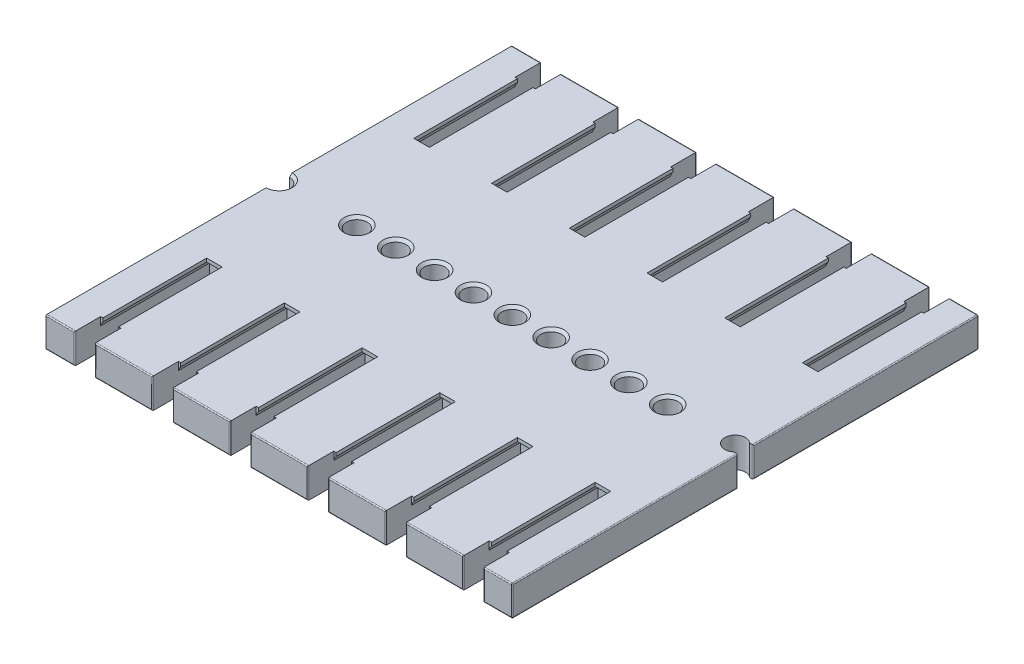
from build123d import *

# Parameters (mm, degrees)
SKETCH_1_W                         = 180
SKETCH_1_H                         = 90
EXTRUDE_1_DEPTH                    = 5.8
CUT_EXTRUDE_1_DEPTH                = 26
SKETCH_3_W                         = 3
SKETCH_3_H                         = 0.677124344
EXTRUDE_2_DEPTH                    = 1
SKETCH_4_W                         = 3.9
SKETCH_4_H                         = 5.8
CUT_EXTRUDE_2_DEPTH                = 5
PATTERN_LINEAR_4_COUNT             = 12
PATTERN_LINEAR_4_PITCH             = 15
PATTERN_LINEAR_4_COPY_1_DEPTH      = 26
PATTERN_LINEAR_4_COPY_2_DEPTH      = 26
PATTERN_LINEAR_4_COPY_3_DEPTH      = 26
PATTERN_LINEAR_4_COPY_4_DEPTH      = 26
PATTERN_LINEAR_4_COPY_5_DEPTH      = 26
PATTERN_LINEAR_4_COPY_6_DEPTH      = 26
PATTERN_LINEAR_4_COPY_7_DEPTH      = 26
PATTERN_LINEAR_4_COPY_8_DEPTH      = 26
PATTERN_LINEAR_4_COPY_9_DEPTH      = 26
PATTERN_LINEAR_4_COPY_10_DEPTH     = 26
PATTERN_LINEAR_4_COPY_11_DEPTH     = 26
PATTERN_LINEAR_4_COPY_12_SKETCH_W  = 3
PATTERN_LINEAR_4_COPY_12_SKETCH_H  = 0.677124344
PATTERN_LINEAR_4_COPY_12_DEPTH     = 1
PATTERN_LINEAR_4_COPY_13_SKETCH_W  = 3
PATTERN_LINEAR_4_COPY_13_SKETCH_H  = 0.677124344
PATTERN_LINEAR_4_COPY_13_DEPTH     = 1
PATTERN_LINEAR_4_COPY_14_SKETCH_W  = 3
PATTERN_LINEAR_4_COPY_14_SKETCH_H  = 0.677124344
PATTERN_LINEAR_4_COPY_14_DEPTH     = 1
PATTERN_LINEAR_4_COPY_15_SKETCH_W  = 3
PATTERN_LINEAR_4_COPY_15_SKETCH_H  = 0.677124344
PATTERN_LINEAR_4_COPY_15_DEPTH     = 1
PATTERN_LINEAR_4_COPY_16_SKETCH_W  = 3
PATTERN_LINEAR_4_COPY_16_SKETCH_H  = 0.677124344
PATTERN_LINEAR_4_COPY_16_DEPTH     = 1
PATTERN_LINEAR_4_COPY_17_SKETCH_W  = 3
PATTERN_LINEAR_4_COPY_17_SKETCH_H  = 0.677124344
PATTERN_LINEAR_4_COPY_17_DEPTH     = 1
PATTERN_LINEAR_4_COPY_18_SKETCH_W  = 3
PATTERN_LINEAR_4_COPY_18_SKETCH_H  = 0.677124344
PATTERN_LINEAR_4_COPY_18_DEPTH     = 1
PATTERN_LINEAR_4_COPY_19_SKETCH_W  = 3
PATTERN_LINEAR_4_COPY_19_SKETCH_H  = 0.677124344
PATTERN_LINEAR_4_COPY_19_DEPTH     = 1
PATTERN_LINEAR_4_COPY_20_SKETCH_W  = 3
PATTERN_LINEAR_4_COPY_20_SKETCH_H  = 0.677124344
PATTERN_LINEAR_4_COPY_20_DEPTH     = 1
PATTERN_LINEAR_4_COPY_21_SKETCH_W  = 3
PATTERN_LINEAR_4_COPY_21_SKETCH_H  = 0.677124344
PATTERN_LINEAR_4_COPY_21_DEPTH     = 1
PATTERN_LINEAR_4_COPY_22_SKETCH_W  = 3
PATTERN_LINEAR_4_COPY_22_SKETCH_H  = 0.677124344
PATTERN_LINEAR_4_COPY_22_DEPTH     = 1
PATTERN_LINEAR_4_COPY_23_SKETCH_W  = 3.9
PATTERN_LINEAR_4_COPY_23_SKETCH_H  = 5.8
PATTERN_LINEAR_4_COPY_23_DEPTH     = 5
PATTERN_LINEAR_4_COPY_24_SKETCH_W  = 3.9
PATTERN_LINEAR_4_COPY_24_SKETCH_H  = 5.8
PATTERN_LINEAR_4_COPY_24_DEPTH     = 5
PATTERN_LINEAR_4_COPY_25_SKETCH_W  = 3.9
PATTERN_LINEAR_4_COPY_25_SKETCH_H  = 5.8
PATTERN_LINEAR_4_COPY_25_DEPTH     = 5
PATTERN_LINEAR_4_COPY_26_SKETCH_W  = 3.9
PATTERN_LINEAR_4_COPY_26_SKETCH_H  = 5.8
PATTERN_LINEAR_4_COPY_26_DEPTH     = 5
PATTERN_LINEAR_4_COPY_27_SKETCH_W  = 3.9
PATTERN_LINEAR_4_COPY_27_SKETCH_H  = 5.8
PATTERN_LINEAR_4_COPY_27_DEPTH     = 5
PATTERN_LINEAR_4_COPY_28_SKETCH_W  = 3.9
PATTERN_LINEAR_4_COPY_28_SKETCH_H  = 5.8
PATTERN_LINEAR_4_COPY_28_DEPTH     = 5
PATTERN_LINEAR_4_COPY_29_SKETCH_W  = 3.9
PATTERN_LINEAR_4_COPY_29_SKETCH_H  = 5.8
PATTERN_LINEAR_4_COPY_29_DEPTH     = 5
PATTERN_LINEAR_4_COPY_30_SKETCH_W  = 3.9
PATTERN_LINEAR_4_COPY_30_SKETCH_H  = 5.8
PATTERN_LINEAR_4_COPY_30_DEPTH     = 5
PATTERN_LINEAR_4_COPY_31_SKETCH_W  = 3.9
PATTERN_LINEAR_4_COPY_31_SKETCH_H  = 5.8
PATTERN_LINEAR_4_COPY_31_DEPTH     = 5
PATTERN_LINEAR_4_COPY_32_SKETCH_W  = 3.9
PATTERN_LINEAR_4_COPY_32_SKETCH_H  = 5.8
PATTERN_LINEAR_4_COPY_32_DEPTH     = 5
PATTERN_LINEAR_4_COPY_33_SKETCH_W  = 3.9
PATTERN_LINEAR_4_COPY_33_SKETCH_H  = 5.8
PATTERN_LINEAR_4_COPY_33_DEPTH     = 5
CUT_EXTRUDE_3_REACH                = 102.79
SKETCH_6_R                         = 2
CHAMFER_1_SIZE                     = 0.5
PATTERN_LINEAR_5_COUNT             = 11
PATTERN_LINEAR_5_PITCH             = 15
CHAMFER_1_OF_PATTERN_LINEAR_5_SIZE = 0.5
CUT_EXTRUDE_4_REACH                = 102.79
SKETCH_7_R                         = 2
CHAMFER_2_SIZE                     = 0.5
PATTERN_LINEAR_7_COUNT             = 4
PATTERN_LINEAR_7_PITCH             = 15
CHAMFER_2_OF_PATTERN_LINEAR_7_SIZE = 0.5
CUT_EXTRUDE_5_REACH                = 102.79
FILLET_4_R                         = 0.2
CUT_EXTRUDE_7_REACH                = 102.79
SKETCH_9_W                         = 94.158249158
SKETCH_9_H                         = 98.711355984


# Read off the part's stored shape, not the designer's step: 镜向5
with BuildPart() as part:
    # 草图1 → 凸台-拉伸1 (new body)
    with BuildSketch(Plane(origin=(0, 0, 0), x_dir=(1, 0, 0), z_dir=(0, 1, 0))):
        Rectangle(SKETCH_1_W, SKETCH_1_H)
    extrude(amount=EXTRUDE_1_DEPTH)

    # 草图2 → 切除-拉伸1 (cut)
    with BuildSketch(Plane.XY.offset(45)):
        with BuildLine():
            Line((-81, 5.8), (-84, 5.8))
            Line((-84, 5.8), (-84, 5.122875656))
            ThreePointArc((-84, 5.122875656), (-84.280042303, 4.711838473), (-84.45, 4.244409721))
            Line((-84.45, 4.244409721), (-84.45, 1.555590279))
            ThreePointArc((-84.45, 1.555590279), (-84.280042303, 1.088161527), (-84, 0.677124344))
            Line((-84, 0.677124344), (-84, 0))
            Line((-84, 0), (-81, 0))
            Line((-81, 0), (-81, 0.677124344))
            ThreePointArc((-81, 0.677124344), (-80.719957697, 1.088161527), (-80.55, 1.555590279))
            Line((-80.55, 1.555590279), (-80.55, 4.244409721))
            ThreePointArc((-80.55, 4.244409721), (-80.719957697, 4.711838473), (-81, 5.122875656))
            Line((-81, 5.122875656), (-81, 5.8))
        make_face()
    cut_extrude_1 = extrude(amount=-CUT_EXTRUDE_1_DEPTH, mode=Mode.SUBTRACT)

    # 草图3 → 凸台-拉伸2 (add)
    with BuildSketch(Plane.XY.offset(19)):
        with Locations((-82.5, 5.461437828)):
            Rectangle(SKETCH_3_W, SKETCH_3_H)
        with Locations((-82.5, 0.338562172)):
            Rectangle(SKETCH_3_W, SKETCH_3_H)
    extrude_2 = extrude(amount=EXTRUDE_2_DEPTH)

    # 草图4 → 切除-拉伸2 (cut)
    with BuildSketch(Plane.XY.offset(45)):
        with Locations((-82.5, 2.9)):
            Rectangle(SKETCH_4_W, SKETCH_4_H)
    cut_extrude_2 = extrude(amount=-CUT_EXTRUDE_2_DEPTH, mode=Mode.SUBTRACT)

    # 镜向4: 切除-拉伸1, 凸台-拉伸2, 切除-拉伸2 across plane
    add(cut_extrude_1.mirror(Plane.XY), mode=Mode.SUBTRACT)
    add(extrude_2.mirror(Plane.XY))
    add(cut_extrude_2.mirror(Plane.XY), mode=Mode.SUBTRACT)

    # 阵列(线性)4: 切除-拉伸1, 凸台-拉伸2, 切除-拉伸2 ×12
    with Locations(*[(i * PATTERN_LINEAR_4_PITCH, 0, 0) for i in range(1, PATTERN_LINEAR_4_COUNT)]):
        add(cut_extrude_1, mode=Mode.SUBTRACT)
        add(extrude_2)
        add(cut_extrude_2, mode=Mode.SUBTRACT)

    # 阵列(线性)4 copy 1 sketch → 阵列(线性)4 copy 1 (cut)
    with BuildSketch(Plane(origin=(15, 0, -45), x_dir=(1, 0, 0), z_dir=(0, 0, -1))):
        with BuildLine():
            Line((-81, -5.8), (-84, -5.8))
            Line((-84, -5.8), (-84, -5.122875656))
            ThreePointArc((-84, -5.122875656), (-84.280042303, -4.711838473), (-84.45, -4.244409721))
            Line((-84.45, -4.244409721), (-84.45, -1.555590279))
            ThreePointArc((-84.45, -1.555590279), (-84.280042303, -1.088161527), (-84, -0.677124344))
            Line((-84, -0.677124344), (-84, 0))
            Line((-84, 0), (-81, 0))
            Line((-81, 0), (-81, -0.677124344))
            ThreePointArc((-81, -0.677124344), (-80.719957697, -1.088161527), (-80.55, -1.555590279))
            Line((-80.55, -1.555590279), (-80.55, -4.244409721))
            ThreePointArc((-80.55, -4.244409721), (-80.719957697, -4.711838473), (-81, -5.122875656))
            Line((-81, -5.122875656), (-81, -5.8))
        make_face()
    extrude(amount=-PATTERN_LINEAR_4_COPY_1_DEPTH, mode=Mode.SUBTRACT)

    # 阵列(线性)4 copy 2 sketch → 阵列(线性)4 copy 2 (cut)
    with BuildSketch(Plane(origin=(30, 0, -45), x_dir=(1, 0, 0), z_dir=(0, 0, -1))):
        with BuildLine():
            Line((-81, -5.8), (-84, -5.8))
            Line((-84, -5.8), (-84, -5.122875656))
            ThreePointArc((-84, -5.122875656), (-84.280042303, -4.711838473), (-84.45, -4.244409721))
            Line((-84.45, -4.244409721), (-84.45, -1.555590279))
            ThreePointArc((-84.45, -1.555590279), (-84.280042303, -1.088161527), (-84, -0.677124344))
            Line((-84, -0.677124344), (-84, 0))
            Line((-84, 0), (-81, 0))
            Line((-81, 0), (-81, -0.677124344))
            ThreePointArc((-81, -0.677124344), (-80.719957697, -1.088161527), (-80.55, -1.555590279))
            Line((-80.55, -1.555590279), (-80.55, -4.244409721))
            ThreePointArc((-80.55, -4.244409721), (-80.719957697, -4.711838473), (-81, -5.122875656))
            Line((-81, -5.122875656), (-81, -5.8))
        make_face()
    extrude(amount=-PATTERN_LINEAR_4_COPY_2_DEPTH, mode=Mode.SUBTRACT)

    # 阵列(线性)4 copy 3 sketch → 阵列(线性)4 copy 3 (cut)
    with BuildSketch(Plane(origin=(45, 0, -45), x_dir=(1, 0, 0), z_dir=(0, 0, -1))):
        with BuildLine():
            Line((-81, -5.8), (-84, -5.8))
            Line((-84, -5.8), (-84, -5.122875656))
            ThreePointArc((-84, -5.122875656), (-84.280042303, -4.711838473), (-84.45, -4.244409721))
            Line((-84.45, -4.244409721), (-84.45, -1.555590279))
            ThreePointArc((-84.45, -1.555590279), (-84.280042303, -1.088161527), (-84, -0.677124344))
            Line((-84, -0.677124344), (-84, 0))
            Line((-84, 0), (-81, 0))
            Line((-81, 0), (-81, -0.677124344))
            ThreePointArc((-81, -0.677124344), (-80.719957697, -1.088161527), (-80.55, -1.555590279))
            Line((-80.55, -1.555590279), (-80.55, -4.244409721))
            ThreePointArc((-80.55, -4.244409721), (-80.719957697, -4.711838473), (-81, -5.122875656))
            Line((-81, -5.122875656), (-81, -5.8))
        make_face()
    extrude(amount=-PATTERN_LINEAR_4_COPY_3_DEPTH, mode=Mode.SUBTRACT)

    # 阵列(线性)4 copy 4 sketch → 阵列(线性)4 copy 4 (cut)
    with BuildSketch(Plane(origin=(60, 0, -45), x_dir=(1, 0, 0), z_dir=(0, 0, -1))):
        with BuildLine():
            Line((-81, -5.8), (-84, -5.8))
            Line((-84, -5.8), (-84, -5.122875656))
            ThreePointArc((-84, -5.122875656), (-84.280042303, -4.711838473), (-84.45, -4.244409721))
            Line((-84.45, -4.244409721), (-84.45, -1.555590279))
            ThreePointArc((-84.45, -1.555590279), (-84.280042303, -1.088161527), (-84, -0.677124344))
            Line((-84, -0.677124344), (-84, 0))
            Line((-84, 0), (-81, 0))
            Line((-81, 0), (-81, -0.677124344))
            ThreePointArc((-81, -0.677124344), (-80.719957697, -1.088161527), (-80.55, -1.555590279))
            Line((-80.55, -1.555590279), (-80.55, -4.244409721))
            ThreePointArc((-80.55, -4.244409721), (-80.719957697, -4.711838473), (-81, -5.122875656))
            Line((-81, -5.122875656), (-81, -5.8))
        make_face()
    extrude(amount=-PATTERN_LINEAR_4_COPY_4_DEPTH, mode=Mode.SUBTRACT)

    # 阵列(线性)4 copy 5 sketch → 阵列(线性)4 copy 5 (cut)
    with BuildSketch(Plane(origin=(75, 0, -45), x_dir=(1, 0, 0), z_dir=(0, 0, -1))):
        with BuildLine():
            Line((-81, -5.8), (-84, -5.8))
            Line((-84, -5.8), (-84, -5.122875656))
            ThreePointArc((-84, -5.122875656), (-84.280042303, -4.711838473), (-84.45, -4.244409721))
            Line((-84.45, -4.244409721), (-84.45, -1.555590279))
            ThreePointArc((-84.45, -1.555590279), (-84.280042303, -1.088161527), (-84, -0.677124344))
            Line((-84, -0.677124344), (-84, 0))
            Line((-84, 0), (-81, 0))
            Line((-81, 0), (-81, -0.677124344))
            ThreePointArc((-81, -0.677124344), (-80.719957697, -1.088161527), (-80.55, -1.555590279))
            Line((-80.55, -1.555590279), (-80.55, -4.244409721))
            ThreePointArc((-80.55, -4.244409721), (-80.719957697, -4.711838473), (-81, -5.122875656))
            Line((-81, -5.122875656), (-81, -5.8))
        make_face()
    extrude(amount=-PATTERN_LINEAR_4_COPY_5_DEPTH, mode=Mode.SUBTRACT)

    # 阵列(线性)4 copy 6 sketch → 阵列(线性)4 copy 6 (cut)
    with BuildSketch(Plane(origin=(90, 0, -45), x_dir=(1, 0, 0), z_dir=(0, 0, -1))):
        with BuildLine():
            Line((-81, -5.8), (-84, -5.8))
            Line((-84, -5.8), (-84, -5.122875656))
            ThreePointArc((-84, -5.122875656), (-84.280042303, -4.711838473), (-84.45, -4.244409721))
            Line((-84.45, -4.244409721), (-84.45, -1.555590279))
            ThreePointArc((-84.45, -1.555590279), (-84.280042303, -1.088161527), (-84, -0.677124344))
            Line((-84, -0.677124344), (-84, 0))
            Line((-84, 0), (-81, 0))
            Line((-81, 0), (-81, -0.677124344))
            ThreePointArc((-81, -0.677124344), (-80.719957697, -1.088161527), (-80.55, -1.555590279))
            Line((-80.55, -1.555590279), (-80.55, -4.244409721))
            ThreePointArc((-80.55, -4.244409721), (-80.719957697, -4.711838473), (-81, -5.122875656))
            Line((-81, -5.122875656), (-81, -5.8))
        make_face()
    extrude(amount=-PATTERN_LINEAR_4_COPY_6_DEPTH, mode=Mode.SUBTRACT)

    # 阵列(线性)4 copy 7 sketch → 阵列(线性)4 copy 7 (cut)
    with BuildSketch(Plane(origin=(105, 0, -45), x_dir=(1, 0, 0), z_dir=(0, 0, -1))):
        with BuildLine():
            Line((-81, -5.8), (-84, -5.8))
            Line((-84, -5.8), (-84, -5.122875656))
            ThreePointArc((-84, -5.122875656), (-84.280042303, -4.711838473), (-84.45, -4.244409721))
            Line((-84.45, -4.244409721), (-84.45, -1.555590279))
            ThreePointArc((-84.45, -1.555590279), (-84.280042303, -1.088161527), (-84, -0.677124344))
            Line((-84, -0.677124344), (-84, 0))
            Line((-84, 0), (-81, 0))
            Line((-81, 0), (-81, -0.677124344))
            ThreePointArc((-81, -0.677124344), (-80.719957697, -1.088161527), (-80.55, -1.555590279))
            Line((-80.55, -1.555590279), (-80.55, -4.244409721))
            ThreePointArc((-80.55, -4.244409721), (-80.719957697, -4.711838473), (-81, -5.122875656))
            Line((-81, -5.122875656), (-81, -5.8))
        make_face()
    extrude(amount=-PATTERN_LINEAR_4_COPY_7_DEPTH, mode=Mode.SUBTRACT)

    # 阵列(线性)4 copy 8 sketch → 阵列(线性)4 copy 8 (cut)
    with BuildSketch(Plane(origin=(120, 0, -45), x_dir=(1, 0, 0), z_dir=(0, 0, -1))):
        with BuildLine():
            Line((-81, -5.8), (-84, -5.8))
            Line((-84, -5.8), (-84, -5.122875656))
            ThreePointArc((-84, -5.122875656), (-84.280042303, -4.711838473), (-84.45, -4.244409721))
            Line((-84.45, -4.244409721), (-84.45, -1.555590279))
            ThreePointArc((-84.45, -1.555590279), (-84.280042303, -1.088161527), (-84, -0.677124344))
            Line((-84, -0.677124344), (-84, 0))
            Line((-84, 0), (-81, 0))
            Line((-81, 0), (-81, -0.677124344))
            ThreePointArc((-81, -0.677124344), (-80.719957697, -1.088161527), (-80.55, -1.555590279))
            Line((-80.55, -1.555590279), (-80.55, -4.244409721))
            ThreePointArc((-80.55, -4.244409721), (-80.719957697, -4.711838473), (-81, -5.122875656))
            Line((-81, -5.122875656), (-81, -5.8))
        make_face()
    extrude(amount=-PATTERN_LINEAR_4_COPY_8_DEPTH, mode=Mode.SUBTRACT)

    # 阵列(线性)4 copy 9 sketch → 阵列(线性)4 copy 9 (cut)
    with BuildSketch(Plane(origin=(135, 0, -45), x_dir=(1, 0, 0), z_dir=(0, 0, -1))):
        with BuildLine():
            Line((-81, -5.8), (-84, -5.8))
            Line((-84, -5.8), (-84, -5.122875656))
            ThreePointArc((-84, -5.122875656), (-84.280042303, -4.711838473), (-84.45, -4.244409721))
            Line((-84.45, -4.244409721), (-84.45, -1.555590279))
            ThreePointArc((-84.45, -1.555590279), (-84.280042303, -1.088161527), (-84, -0.677124344))
            Line((-84, -0.677124344), (-84, 0))
            Line((-84, 0), (-81, 0))
            Line((-81, 0), (-81, -0.677124344))
            ThreePointArc((-81, -0.677124344), (-80.719957697, -1.088161527), (-80.55, -1.555590279))
            Line((-80.55, -1.555590279), (-80.55, -4.244409721))
            ThreePointArc((-80.55, -4.244409721), (-80.719957697, -4.711838473), (-81, -5.122875656))
            Line((-81, -5.122875656), (-81, -5.8))
        make_face()
    extrude(amount=-PATTERN_LINEAR_4_COPY_9_DEPTH, mode=Mode.SUBTRACT)

    # 阵列(线性)4 copy 10 sketch → 阵列(线性)4 copy 10 (cut)
    with BuildSketch(Plane(origin=(150, 0, -45), x_dir=(1, 0, 0), z_dir=(0, 0, -1))):
        with BuildLine():
            Line((-81, -5.8), (-84, -5.8))
            Line((-84, -5.8), (-84, -5.122875656))
            ThreePointArc((-84, -5.122875656), (-84.280042303, -4.711838473), (-84.45, -4.244409721))
            Line((-84.45, -4.244409721), (-84.45, -1.555590279))
            ThreePointArc((-84.45, -1.555590279), (-84.280042303, -1.088161527), (-84, -0.677124344))
            Line((-84, -0.677124344), (-84, 0))
            Line((-84, 0), (-81, 0))
            Line((-81, 0), (-81, -0.677124344))
            ThreePointArc((-81, -0.677124344), (-80.719957697, -1.088161527), (-80.55, -1.555590279))
            Line((-80.55, -1.555590279), (-80.55, -4.244409721))
            ThreePointArc((-80.55, -4.244409721), (-80.719957697, -4.711838473), (-81, -5.122875656))
            Line((-81, -5.122875656), (-81, -5.8))
        make_face()
    extrude(amount=-PATTERN_LINEAR_4_COPY_10_DEPTH, mode=Mode.SUBTRACT)

    # 阵列(线性)4 copy 11 sketch → 阵列(线性)4 copy 11 (cut)
    with BuildSketch(Plane(origin=(165, 0, -45), x_dir=(1, 0, 0), z_dir=(0, 0, -1))):
        with BuildLine():
            Line((-81, -5.8), (-84, -5.8))
            Line((-84, -5.8), (-84, -5.122875656))
            ThreePointArc((-84, -5.122875656), (-84.280042303, -4.711838473), (-84.45, -4.244409721))
            Line((-84.45, -4.244409721), (-84.45, -1.555590279))
            ThreePointArc((-84.45, -1.555590279), (-84.280042303, -1.088161527), (-84, -0.677124344))
            Line((-84, -0.677124344), (-84, 0))
            Line((-84, 0), (-81, 0))
            Line((-81, 0), (-81, -0.677124344))
            ThreePointArc((-81, -0.677124344), (-80.719957697, -1.088161527), (-80.55, -1.555590279))
            Line((-80.55, -1.555590279), (-80.55, -4.244409721))
            ThreePointArc((-80.55, -4.244409721), (-80.719957697, -4.711838473), (-81, -5.122875656))
            Line((-81, -5.122875656), (-81, -5.8))
        make_face()
    extrude(amount=-PATTERN_LINEAR_4_COPY_11_DEPTH, mode=Mode.SUBTRACT)

    # 阵列(线性)4 copy 12 sketch → 阵列(线性)4 copy 12 (add)
    with BuildSketch(Plane(origin=(15, 0, -19), x_dir=(1, 0, 0), z_dir=(0, 0, -1))):
        with Locations((-82.5, -5.461437828)):
            Rectangle(PATTERN_LINEAR_4_COPY_12_SKETCH_W, PATTERN_LINEAR_4_COPY_12_SKETCH_H)
        with Locations((-82.5, -0.338562172)):
            Rectangle(PATTERN_LINEAR_4_COPY_12_SKETCH_W, PATTERN_LINEAR_4_COPY_12_SKETCH_H)
    extrude(amount=PATTERN_LINEAR_4_COPY_12_DEPTH)

    # 阵列(线性)4 copy 13 sketch → 阵列(线性)4 copy 13 (add)
    with BuildSketch(Plane(origin=(30, 0, -19), x_dir=(1, 0, 0), z_dir=(0, 0, -1))):
        with Locations((-82.5, -5.461437828)):
            Rectangle(PATTERN_LINEAR_4_COPY_13_SKETCH_W, PATTERN_LINEAR_4_COPY_13_SKETCH_H)
        with Locations((-82.5, -0.338562172)):
            Rectangle(PATTERN_LINEAR_4_COPY_13_SKETCH_W, PATTERN_LINEAR_4_COPY_13_SKETCH_H)
    extrude(amount=PATTERN_LINEAR_4_COPY_13_DEPTH)

    # 阵列(线性)4 copy 14 sketch → 阵列(线性)4 copy 14 (add)
    with BuildSketch(Plane(origin=(45, 0, -19), x_dir=(1, 0, 0), z_dir=(0, 0, -1))):
        with Locations((-82.5, -5.461437828)):
            Rectangle(PATTERN_LINEAR_4_COPY_14_SKETCH_W, PATTERN_LINEAR_4_COPY_14_SKETCH_H)
        with Locations((-82.5, -0.338562172)):
            Rectangle(PATTERN_LINEAR_4_COPY_14_SKETCH_W, PATTERN_LINEAR_4_COPY_14_SKETCH_H)
    extrude(amount=PATTERN_LINEAR_4_COPY_14_DEPTH)

    # 阵列(线性)4 copy 15 sketch → 阵列(线性)4 copy 15 (add)
    with BuildSketch(Plane(origin=(60, 0, -19), x_dir=(1, 0, 0), z_dir=(0, 0, -1))):
        with Locations((-82.5, -5.461437828)):
            Rectangle(PATTERN_LINEAR_4_COPY_15_SKETCH_W, PATTERN_LINEAR_4_COPY_15_SKETCH_H)
        with Locations((-82.5, -0.338562172)):
            Rectangle(PATTERN_LINEAR_4_COPY_15_SKETCH_W, PATTERN_LINEAR_4_COPY_15_SKETCH_H)
    extrude(amount=PATTERN_LINEAR_4_COPY_15_DEPTH)

    # 阵列(线性)4 copy 16 sketch → 阵列(线性)4 copy 16 (add)
    with BuildSketch(Plane(origin=(75, 0, -19), x_dir=(1, 0, 0), z_dir=(0, 0, -1))):
        with Locations((-82.5, -5.461437828)):
            Rectangle(PATTERN_LINEAR_4_COPY_16_SKETCH_W, PATTERN_LINEAR_4_COPY_16_SKETCH_H)
        with Locations((-82.5, -0.338562172)):
            Rectangle(PATTERN_LINEAR_4_COPY_16_SKETCH_W, PATTERN_LINEAR_4_COPY_16_SKETCH_H)
    extrude(amount=PATTERN_LINEAR_4_COPY_16_DEPTH)

    # 阵列(线性)4 copy 17 sketch → 阵列(线性)4 copy 17 (add)
    with BuildSketch(Plane(origin=(90, 0, -19), x_dir=(1, 0, 0), z_dir=(0, 0, -1))):
        with Locations((-82.5, -5.461437828)):
            Rectangle(PATTERN_LINEAR_4_COPY_17_SKETCH_W, PATTERN_LINEAR_4_COPY_17_SKETCH_H)
        with Locations((-82.5, -0.338562172)):
            Rectangle(PATTERN_LINEAR_4_COPY_17_SKETCH_W, PATTERN_LINEAR_4_COPY_17_SKETCH_H)
    extrude(amount=PATTERN_LINEAR_4_COPY_17_DEPTH)

    # 阵列(线性)4 copy 18 sketch → 阵列(线性)4 copy 18 (add)
    with BuildSketch(Plane(origin=(105, 0, -19), x_dir=(1, 0, 0), z_dir=(0, 0, -1))):
        with Locations((-82.5, -5.461437828)):
            Rectangle(PATTERN_LINEAR_4_COPY_18_SKETCH_W, PATTERN_LINEAR_4_COPY_18_SKETCH_H)
        with Locations((-82.5, -0.338562172)):
            Rectangle(PATTERN_LINEAR_4_COPY_18_SKETCH_W, PATTERN_LINEAR_4_COPY_18_SKETCH_H)
    extrude(amount=PATTERN_LINEAR_4_COPY_18_DEPTH)

    # 阵列(线性)4 copy 19 sketch → 阵列(线性)4 copy 19 (add)
    with BuildSketch(Plane(origin=(120, 0, -19), x_dir=(1, 0, 0), z_dir=(0, 0, -1))):
        with Locations((-82.5, -5.461437828)):
            Rectangle(PATTERN_LINEAR_4_COPY_19_SKETCH_W, PATTERN_LINEAR_4_COPY_19_SKETCH_H)
        with Locations((-82.5, -0.338562172)):
            Rectangle(PATTERN_LINEAR_4_COPY_19_SKETCH_W, PATTERN_LINEAR_4_COPY_19_SKETCH_H)
    extrude(amount=PATTERN_LINEAR_4_COPY_19_DEPTH)

    # 阵列(线性)4 copy 20 sketch → 阵列(线性)4 copy 20 (add)
    with BuildSketch(Plane(origin=(135, 0, -19), x_dir=(1, 0, 0), z_dir=(0, 0, -1))):
        with Locations((-82.5, -5.461437828)):
            Rectangle(PATTERN_LINEAR_4_COPY_20_SKETCH_W, PATTERN_LINEAR_4_COPY_20_SKETCH_H)
        with Locations((-82.5, -0.338562172)):
            Rectangle(PATTERN_LINEAR_4_COPY_20_SKETCH_W, PATTERN_LINEAR_4_COPY_20_SKETCH_H)
    extrude(amount=PATTERN_LINEAR_4_COPY_20_DEPTH)

    # 阵列(线性)4 copy 21 sketch → 阵列(线性)4 copy 21 (add)
    with BuildSketch(Plane(origin=(150, 0, -19), x_dir=(1, 0, 0), z_dir=(0, 0, -1))):
        with Locations((-82.5, -5.461437828)):
            Rectangle(PATTERN_LINEAR_4_COPY_21_SKETCH_W, PATTERN_LINEAR_4_COPY_21_SKETCH_H)
        with Locations((-82.5, -0.338562172)):
            Rectangle(PATTERN_LINEAR_4_COPY_21_SKETCH_W, PATTERN_LINEAR_4_COPY_21_SKETCH_H)
    extrude(amount=PATTERN_LINEAR_4_COPY_21_DEPTH)

    # 阵列(线性)4 copy 22 sketch → 阵列(线性)4 copy 22 (add)
    with BuildSketch(Plane(origin=(165, 0, -19), x_dir=(1, 0, 0), z_dir=(0, 0, -1))):
        with Locations((-82.5, -5.461437828)):
            Rectangle(PATTERN_LINEAR_4_COPY_22_SKETCH_W, PATTERN_LINEAR_4_COPY_22_SKETCH_H)
        with Locations((-82.5, -0.338562172)):
            Rectangle(PATTERN_LINEAR_4_COPY_22_SKETCH_W, PATTERN_LINEAR_4_COPY_22_SKETCH_H)
    extrude(amount=PATTERN_LINEAR_4_COPY_22_DEPTH)

    # 阵列(线性)4 copy 23 sketch → 阵列(线性)4 copy 23 (cut)
    with BuildSketch(Plane(origin=(15, 0, -45), x_dir=(1, 0, 0), z_dir=(0, 0, -1))):
        with Locations((-82.5, -2.9)):
            Rectangle(PATTERN_LINEAR_4_COPY_23_SKETCH_W, PATTERN_LINEAR_4_COPY_23_SKETCH_H)
    extrude(amount=-PATTERN_LINEAR_4_COPY_23_DEPTH, mode=Mode.SUBTRACT)

    # 阵列(线性)4 copy 24 sketch → 阵列(线性)4 copy 24 (cut)
    with BuildSketch(Plane(origin=(30, 0, -45), x_dir=(1, 0, 0), z_dir=(0, 0, -1))):
        with Locations((-82.5, -2.9)):
            Rectangle(PATTERN_LINEAR_4_COPY_24_SKETCH_W, PATTERN_LINEAR_4_COPY_24_SKETCH_H)
    extrude(amount=-PATTERN_LINEAR_4_COPY_24_DEPTH, mode=Mode.SUBTRACT)

    # 阵列(线性)4 copy 25 sketch → 阵列(线性)4 copy 25 (cut)
    with BuildSketch(Plane(origin=(45, 0, -45), x_dir=(1, 0, 0), z_dir=(0, 0, -1))):
        with Locations((-82.5, -2.9)):
            Rectangle(PATTERN_LINEAR_4_COPY_25_SKETCH_W, PATTERN_LINEAR_4_COPY_25_SKETCH_H)
    extrude(amount=-PATTERN_LINEAR_4_COPY_25_DEPTH, mode=Mode.SUBTRACT)

    # 阵列(线性)4 copy 26 sketch → 阵列(线性)4 copy 26 (cut)
    with BuildSketch(Plane(origin=(60, 0, -45), x_dir=(1, 0, 0), z_dir=(0, 0, -1))):
        with Locations((-82.5, -2.9)):
            Rectangle(PATTERN_LINEAR_4_COPY_26_SKETCH_W, PATTERN_LINEAR_4_COPY_26_SKETCH_H)
    extrude(amount=-PATTERN_LINEAR_4_COPY_26_DEPTH, mode=Mode.SUBTRACT)

    # 阵列(线性)4 copy 27 sketch → 阵列(线性)4 copy 27 (cut)
    with BuildSketch(Plane(origin=(75, 0, -45), x_dir=(1, 0, 0), z_dir=(0, 0, -1))):
        with Locations((-82.5, -2.9)):
            Rectangle(PATTERN_LINEAR_4_COPY_27_SKETCH_W, PATTERN_LINEAR_4_COPY_27_SKETCH_H)
    extrude(amount=-PATTERN_LINEAR_4_COPY_27_DEPTH, mode=Mode.SUBTRACT)

    # 阵列(线性)4 copy 28 sketch → 阵列(线性)4 copy 28 (cut)
    with BuildSketch(Plane(origin=(90, 0, -45), x_dir=(1, 0, 0), z_dir=(0, 0, -1))):
        with Locations((-82.5, -2.9)):
            Rectangle(PATTERN_LINEAR_4_COPY_28_SKETCH_W, PATTERN_LINEAR_4_COPY_28_SKETCH_H)
    extrude(amount=-PATTERN_LINEAR_4_COPY_28_DEPTH, mode=Mode.SUBTRACT)

    # 阵列(线性)4 copy 29 sketch → 阵列(线性)4 copy 29 (cut)
    with BuildSketch(Plane(origin=(105, 0, -45), x_dir=(1, 0, 0), z_dir=(0, 0, -1))):
        with Locations((-82.5, -2.9)):
            Rectangle(PATTERN_LINEAR_4_COPY_29_SKETCH_W, PATTERN_LINEAR_4_COPY_29_SKETCH_H)
    extrude(amount=-PATTERN_LINEAR_4_COPY_29_DEPTH, mode=Mode.SUBTRACT)

    # 阵列(线性)4 copy 30 sketch → 阵列(线性)4 copy 30 (cut)
    with BuildSketch(Plane(origin=(120, 0, -45), x_dir=(1, 0, 0), z_dir=(0, 0, -1))):
        with Locations((-82.5, -2.9)):
            Rectangle(PATTERN_LINEAR_4_COPY_30_SKETCH_W, PATTERN_LINEAR_4_COPY_30_SKETCH_H)
    extrude(amount=-PATTERN_LINEAR_4_COPY_30_DEPTH, mode=Mode.SUBTRACT)

    # 阵列(线性)4 copy 31 sketch → 阵列(线性)4 copy 31 (cut)
    with BuildSketch(Plane(origin=(135, 0, -45), x_dir=(1, 0, 0), z_dir=(0, 0, -1))):
        with Locations((-82.5, -2.9)):
            Rectangle(PATTERN_LINEAR_4_COPY_31_SKETCH_W, PATTERN_LINEAR_4_COPY_31_SKETCH_H)
    extrude(amount=-PATTERN_LINEAR_4_COPY_31_DEPTH, mode=Mode.SUBTRACT)

    # 阵列(线性)4 copy 32 sketch → 阵列(线性)4 copy 32 (cut)
    with BuildSketch(Plane(origin=(150, 0, -45), x_dir=(1, 0, 0), z_dir=(0, 0, -1))):
        with Locations((-82.5, -2.9)):
            Rectangle(PATTERN_LINEAR_4_COPY_32_SKETCH_W, PATTERN_LINEAR_4_COPY_32_SKETCH_H)
    extrude(amount=-PATTERN_LINEAR_4_COPY_32_DEPTH, mode=Mode.SUBTRACT)

    # 阵列(线性)4 copy 33 sketch → 阵列(线性)4 copy 33 (cut)
    with BuildSketch(Plane(origin=(165, 0, -45), x_dir=(1, 0, 0), z_dir=(0, 0, -1))):
        with Locations((-82.5, -2.9)):
            Rectangle(PATTERN_LINEAR_4_COPY_33_SKETCH_W, PATTERN_LINEAR_4_COPY_33_SKETCH_H)
    extrude(amount=-PATTERN_LINEAR_4_COPY_33_DEPTH, mode=Mode.SUBTRACT)

    # 草图6 → 切除-拉伸3 (cut, up to next)
    with BuildSketch(Plane.XZ, mode=Mode.PRIVATE) as cut_extrude_3_sk1:
        with Locations(Location((-75, 0, 0), (0, 0, 270))):
            Circle(SKETCH_6_R)
    cut_extrude_3_tool1 = extrude(cut_extrude_3_sk1.sketch, amount=-CUT_EXTRUDE_3_REACH, mode=Mode.PRIVATE) & part.part
    cut_extrude_3 = cut_extrude_3_tool1.solids().sort_by_distance((-75, 0, 0))[0]
    add(cut_extrude_3, mode=Mode.SUBTRACT)

    # 倒角1
    chamfer_1_edges = [part.edges().sort_by_distance(p)[0] for p in [
        (-75, 5.8, 2),
        (-75, 0, 2),
    ]]
    chamfer(chamfer_1_edges, length=CHAMFER_1_SIZE)

    # 阵列(线性)5: 切除-拉伸3 ×11
    with Locations(*[(i * PATTERN_LINEAR_5_PITCH, 0, 0) for i in range(1, PATTERN_LINEAR_5_COUNT)]):
        add(cut_extrude_3, mode=Mode.SUBTRACT)

    # 倒角1 of 阵列(线性)5
    chamfer_1_of_pattern_linear_5_edges = [part.edges().sort_by_distance(p)[0] for p in [
        (-60, 5.8, 2),
        (-60, 0, 2),
        (-45, 5.8, 2),
        (-45, 0, 2),
        (-30, 5.8, 2),
        (-30, 0, 2),
        (-15, 5.8, 2),
        (-15, 0, 2),
        (0, 5.8, 2),
        (0, 0, 2),
        (15, 5.8, 2),
        (15, 0, 2),
        (30, 5.8, 2),
        (30, 0, 2),
        (45, 5.8, 2),
        (45, 0, 2),
        (60, 5.8, 2),
        (60, 0, 2),
        (75, 5.8, 2),
        (75, 0, 2),
    ]]
    chamfer(chamfer_1_of_pattern_linear_5_edges, length=CHAMFER_1_OF_PATTERN_LINEAR_5_SIZE)

    # 草图7 → 切除-拉伸4 (cut, up to next)
    with BuildSketch(Plane.XZ, mode=Mode.PRIVATE) as cut_extrude_4_sk1:
        with Locations(Location((-67.5, 0, 0), (0, 0, 270))):
            Circle(SKETCH_7_R)
    cut_extrude_4_tool1 = extrude(cut_extrude_4_sk1.sketch, amount=-CUT_EXTRUDE_4_REACH, mode=Mode.PRIVATE) & part.part
    cut_extrude_4 = cut_extrude_4_tool1.solids().sort_by_distance((-67.5, 0, 0))[0]
    add(cut_extrude_4, mode=Mode.SUBTRACT)

    # 倒角2
    chamfer_2_edges = [part.edges().sort_by_distance(p)[0] for p in [
        (-67.5, 5.8, 2),
        (-67.5, 0, 2),
    ]]
    chamfer(chamfer_2_edges, length=CHAMFER_2_SIZE)

    # 阵列(线性)7: 切除-拉伸4 ×4
    with Locations(*[(i * PATTERN_LINEAR_7_PITCH, 0, 0) for i in range(1, PATTERN_LINEAR_7_COUNT)]):
        add(cut_extrude_4, mode=Mode.SUBTRACT)

    # 倒角2 of 阵列(线性)7
    chamfer_2_of_pattern_linear_7_edges = [part.edges().sort_by_distance(p)[0] for p in [
        (-52.5, 5.8, 2),
        (-52.5, 0, 2),
        (-37.5, 5.8, 2),
        (-37.5, 0, 2),
        (-22.5, 5.8, 2),
        (-22.5, 0, 2),
    ]]
    chamfer(chamfer_2_of_pattern_linear_7_edges, length=CHAMFER_2_OF_PATTERN_LINEAR_7_SIZE)

    # 镜向5 outline → 镜向5 (revolve, cut)
    with BuildSketch(Plane(origin=(67.5, 0, 0), x_dir=(1, 0, 0), z_dir=(0, 0, 1))):
        Polygon((2.5, 5.8), (0, 5.8), (0, 0), (2.5, 0), (2, 0.5), (2, 5.3), align=None)
    revolve(axis=Axis((67.5, 0, 0), (0, 1, 0)), mode=Mode.SUBTRACT)

    # Mirror 5 2 outline → Mirror 5 2 (revolve, cut)
    with BuildSketch(Plane(origin=(52.5, 0, 0), x_dir=(1, 0, 0), z_dir=(0, 0, 1))):
        Polygon((2.5, 5.8), (0, 5.8), (0, 0), (2.5, 0), (2, 0.5), (2, 5.3), align=None)
    revolve(axis=Axis((52.5, 0, 0), (0, 1, 0)), mode=Mode.SUBTRACT)

    # Mirror 5 3 outline → Mirror 5 3 (revolve, cut)
    with BuildSketch(Plane(origin=(37.5, 0, 0), x_dir=(1, 0, 0), z_dir=(0, 0, 1))):
        Polygon((2.5, 5.8), (0, 5.8), (0, 0), (2.5, 0), (2, 0.5), (2, 5.3), align=None)
    revolve(axis=Axis((37.5, 0, 0), (0, 1, 0)), mode=Mode.SUBTRACT)

    # Mirror 5 4 outline → Mirror 5 4 (revolve, cut)
    with BuildSketch(Plane(origin=(22.5, 0, 0), x_dir=(1, 0, 0), z_dir=(0, 0, 1))):
        Polygon((2.5, 5.8), (0, 5.8), (0, 0), (2.5, 0), (2, 0.5), (2, 5.3), align=None)
    revolve(axis=Axis((22.5, 0, 0), (0, 1, 0)), mode=Mode.SUBTRACT)

    # 草图8 → 切除-拉伸5 (cut, up to next)
    with BuildSketch(Plane.XZ, mode=Mode.PRIVATE) as cut_extrude_5_sk1:
        with BuildLine():
            Line((-90, -1.5), (-90, 1.5))
            Line((-90, 1.5), (-89.322875656, 1.5))
            ThreePointArc((-89.322875656, 1.5), (-86, 0), (-89.322875656, -1.5))
            Line((-89.322875656, -1.5), (-90, -1.5))
        make_face()
    cut_extrude_5_tool1 = extrude(cut_extrude_5_sk1.sketch, amount=-CUT_EXTRUDE_5_REACH, mode=Mode.PRIVATE) & part.part
    cut_extrude_5 = cut_extrude_5_tool1.solids().sort_by_distance((-88.085293, 0, 0))[0]
    add(cut_extrude_5, mode=Mode.SUBTRACT)

    # 镜向6: 切除-拉伸5 across plane
    add(cut_extrude_5.mirror(Plane(origin=(0, 0, 0), x_dir=(0, 0, 1), z_dir=(1, 0, 0))), mode=Mode.SUBTRACT)

    # 圆角4
    fillet_4_edges = [part.edges().sort_by_distance(p)[0] for p in [
        (-87.225, 5.8, 45),
        (30, 0, -45),
        (30, 5.8, -45),
        (50.55, 2.9, -45),
        (54.45, 2.9, -45),
        (45, 0, -45),
        (45, 5.8, -45),
        (65.55, 2.9, -45),
        (69.45, 2.9, -45),
        (60, 0, -45),
        (60, 5.8, -45),
        (90, 5.8, 23.25),
        (80.55, 2.9, -45),
        (84.45, 2.9, -45),
        (-84.45, 2.9, -45),
        (75, 0, -45),
        (75, 5.8, -45),
        (-80.55, 2.9, -45),
        (-69.45, 2.9, 45),
        (-65.55, 2.9, 45),
        (-54.45, 2.9, 45),
        (-50.55, 2.9, 45),
        (-39.45, 2.9, 45),
        (-35.55, 2.9, 45),
        (-24.45, 2.9, 45),
        (-20.55, 2.9, 45),
        (-9.45, 2.9, 45),
        (-5.55, 2.9, 45),
        (5.55, 2.9, 45),
        (9.45, 2.9, 45),
        (20.55, 2.9, 45),
        (24.45, 2.9, 45),
        (35.55, 2.9, 45),
        (39.45, 2.9, 45),
        (50.55, 2.9, 45),
        (54.45, 2.9, 45),
        (65.55, 2.9, 45),
        (69.45, 2.9, 45),
        (80.55, 2.9, 45),
        (84.45, 2.9, 45),
        (-87.225, 0, -45),
        (-87.225, 5.8, -45),
        (-60, 0, 45),
        (-60, 5.8, 45),
        (-45, 0, 45),
        (-45, 5.8, 45),
        (-30, 0, 45),
        (-30, 5.8, 45),
        (-15, 0, 45),
        (-15, 5.8, 45),
        (0, 0, 45),
        (0, 5.8, 45),
        (15, 0, 45),
        (15, 5.8, 45),
        (30, 0, 45),
        (30, 5.8, 45),
        (45, 0, 45),
        (45, 5.8, 45),
        (-69.45, 2.9, -45),
        (60, 0, 45),
        (60, 5.8, 45),
        (-65.55, 2.9, -45),
        (75, 0, 45),
        (75, 5.8, 45),
        (87.225, 0, 45),
        (87.225, 5.8, 45),
        (-84.45, 2.9, 45),
        (-90, 0, 23.25),
        (-90, 5.8, 23.25),
        (-90, 2.9, -1.5),
        (-90, 2.9, 1.5),
        (90, 0, -23.25),
        (90, 5.8, -23.25),
        (90, 2.9, -1.5),
        (90, 2.9, 1.5),
        (-80.55, 2.9, 45),
        (-75, 0, -45),
        (-75, 5.8, -45),
        (-54.45, 2.9, -45),
        (-50.55, 2.9, -45),
        (87.225, 5.8, -45),
        (-60, 0, -45),
        (-60, 5.8, -45),
        (90, 0, 23.25),
        (-39.45, 2.9, -45),
        (-35.55, 2.9, -45),
        (-87.225, 0, 45),
        (-45, 0, -45),
        (-45, 5.8, -45),
        (-90, 0, -23.25),
        (-24.45, 2.9, -45),
        (-20.55, 2.9, -45),
        (87.225, 0, -45),
        (-30, 0, -45),
        (-30, 5.8, -45),
        (-9.45, 2.9, -45),
        (-5.55, 2.9, -45),
        (-90, 5.8, -23.25),
        (-15, 0, -45),
        (-15, 5.8, -45),
        (90, 2.9, -45),
        (90, 2.9, 45),
        (-90, 2.9, 45),
        (-90, 2.9, -45),
        (5.55, 2.9, -45),
        (9.45, 2.9, -45),
        (0, 0, -45),
        (0, 5.8, -45),
        (-75, 0, 45),
        (-75, 5.8, 45),
        (20.55, 2.9, -45),
        (24.45, 2.9, -45),
        (15, 0, -45),
        (15, 5.8, -45),
        (35.55, 2.9, -45),
        (39.45, 2.9, -45),
    ]]
    fillet(fillet_4_edges, radius=FILLET_4_R)

    # 草图9 → 切除-拉伸7 (cut, up to next)
    with BuildSketch(Plane(origin=(0, 5.8, 0), x_dir=(1, 0, 0), z_dir=(0, 1, 0)), mode=Mode.PRIVATE) as cut_extrude_7_sk1:
        with Locations((-47.079124579, -0.182124273)):
            Rectangle(SKETCH_9_W, SKETCH_9_H)
    cut_extrude_7_tool1 = extrude(cut_extrude_7_sk1.sketch, amount=-CUT_EXTRUDE_7_REACH, mode=Mode.PRIVATE) & part.part
    add(cut_extrude_7_tool1.solids().sort_by_distance((-47.079125, 5.8, 0.182124))[0], mode=Mode.SUBTRACT)


solid = part.part
